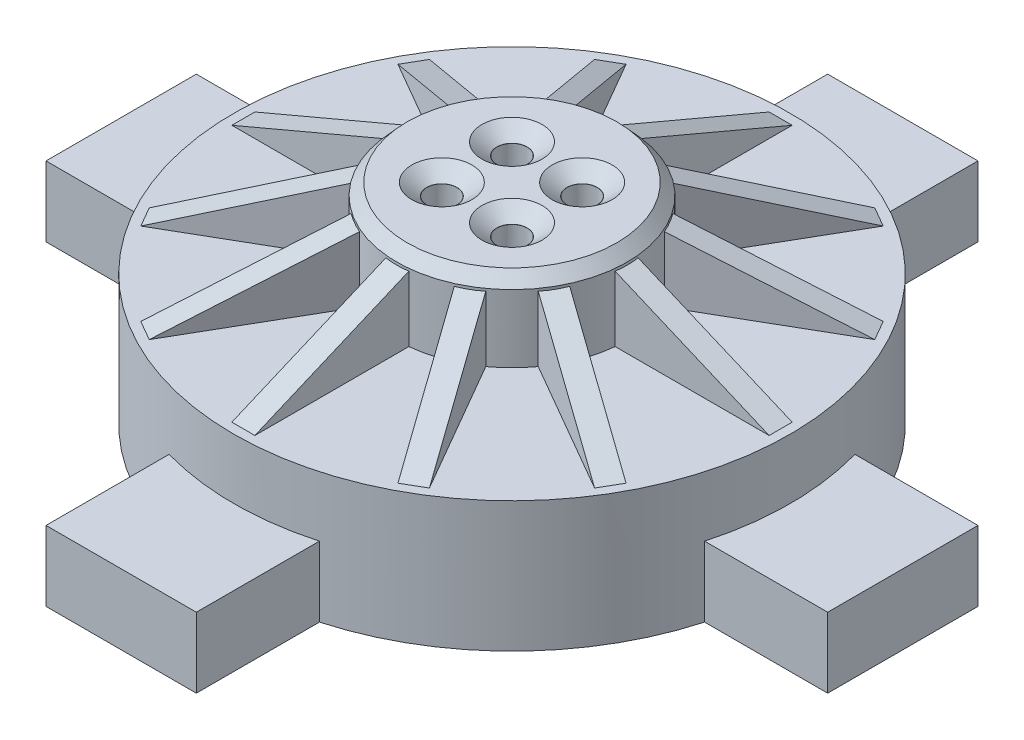
from build123d import *

# Parameters (mm, degrees)
SALIENTE_EXTRUIR1_DEPTH         = 7
CROQUIS2_R                      = 27.75
SALIENTE_EXTRUIR2_DEPTH         = 6
CROQUIS3_R                      = 11.5
SALIENTE_EXTRUIR3_DEPTH         = 6.7
NERVIO5_START                   = -19.605376538
NERVIO5_OUTLINE_W               = 2.3
NERVIO5_OUTLINE_H               = 7.43309969
NERVIO5_DEPTH                   = 16.688717133
MATRIZC1_COUNT                  = 12
CROQUIS5_R                      = 8.65
SALIENTE_EXTRUIR4_DEPTH         = 1.2
CHAFL_N1_SIZE                   = 2.9
CHAFL_N1_SIZE_2                 = 3.2
CORTAR_EXTRUIR1_DEPTH           = 12.6
CROQUIS7_R                      = 3
CORTAR_EXTRUIR2_DEPTH           = 1.2
CORTAR_EXTRUIR2_DRAFT           = -51
CORTAR_EXTRUIR2_PROFILE_2_DEPTH = 1.2
CORTAR_EXTRUIR2_PROFILE_2_DRAFT = -51
CORTAR_EXTRUIR2_PROFILE_3_DEPTH = 1.2
CORTAR_EXTRUIR2_PROFILE_3_DRAFT = -51
CORTAR_EXTRUIR2_PROFILE_4_DEPTH = 1.2
CORTAR_EXTRUIR2_PROFILE_4_DRAFT = -51


# Read off the part's stored shape, not the designer's step: Nervio5
with BuildPart() as part:
    # Croquis1 → Saliente-Extruir1 (new body)
    with BuildSketch(Plane(origin=(0, 0, 0), x_dir=(1, 0, 0), z_dir=(0, 1, 0))):
        with BuildLine():
            Line((-7.5, -39), (7.5, -39))
            Line((7.5, -39), (7.5, -26.717269696))
            ThreePointArc((7.5, -26.717269696), (19.622213178, -19.622213178), (26.717269696, -7.5))
            Line((26.717269696, -7.5), (39, -7.5))
            Line((39, -7.5), (39, 7.5))
            Line((39, 7.5), (26.717269696, 7.5))
            ThreePointArc((26.717269696, 7.5), (19.622213178, 19.622213178), (7.5, 26.717269696))
            Line((7.5, 26.717269696), (7.5, 39))
            Line((7.5, 39), (-7.5, 39))
            Line((-7.5, 39), (-7.5, 26.717269696))
            ThreePointArc((-7.5, 26.717269696), (-19.622213178, 19.622213178), (-26.717269696, 7.5))
            Line((-26.717269696, 7.5), (-39, 7.5))
            Line((-39, 7.5), (-39, -7.5))
            Line((-39, -7.5), (-26.717269696, -7.5))
            ThreePointArc((-26.717269696, -7.5), (-19.622213178, -19.622213178), (-7.5, -26.717269696))
            Line((-7.5, -26.717269696), (-7.5, -39))
        make_face()
    extrude(amount=SALIENTE_EXTRUIR1_DEPTH)

    # Croquis2 → Saliente-Extruir2 (add)
    with BuildSketch(Plane(origin=(0, 7, 0), x_dir=(1, 0, 0), z_dir=(0, 1, 0))):
        with Locations(Location((0, 0, 0), (0, 0, 105.680350135))):
            Circle(CROQUIS2_R)
    extrude(amount=SALIENTE_EXTRUIR2_DEPTH)

    # Croquis3 → Saliente-Extruir3 (add)
    with BuildSketch(Plane(origin=(0, 13, 0), x_dir=(1, 0, 0), z_dir=(0, 1, 0))):
        with Locations(Location((0, 0, 0), (0, 0, 270))):
            Circle(CROQUIS3_R)
    extrude(amount=SALIENTE_EXTRUIR3_DEPTH)

    # Nervio5 outline → Nervio5 (add)
    with BuildSketch(Plane(origin=(0, 0, 0), x_dir=(1, 0, 0), z_dir=(0, 0.39036530164811784, 0.9206600519568415)).offset(NERVIO5_START)):
        with Locations((0, 18.716549845)):
            Rectangle(NERVIO5_OUTLINE_W, NERVIO5_OUTLINE_H)
    nervio5 = extrude(amount=NERVIO5_DEPTH)

    # MatrizC1: Nervio5 ×12 about axis
    matrizc1_axis = Axis((0, 0, 0), (0, 1, 0))
    for i in range(1, MATRIZC1_COUNT):
        add(nervio5.rotate(matrizc1_axis, i * 360 / MATRIZC1_COUNT))

    # Croquis5 → Saliente-Extruir4 (add)
    with BuildSketch(Plane(origin=(0, 19.7, 0), x_dir=(1, 0, 0), z_dir=(0, 1, 0))):
        with Locations(Location((0, 0, 0), (0, 0, 270))):
            Circle(CROQUIS5_R)
    extrude(amount=SALIENTE_EXTRUIR4_DEPTH)

    # Chaflán1
    # the kernel refuses this chamfer: 3.2, 2.9 mm, written as the material it adds along each edge
    with BuildSketch(Plane(origin=(0, 19.7, 0), x_dir=(0, 0, 1), z_dir=(-1, 0, 0))) as chafl_n1_piece_1_section:
        Polygon((8.65 + CHAFL_N1_SIZE, 0), (8.65, CHAFL_N1_SIZE_2), (8.65, 0), align=None)
    chafl_n1_piece_1 = revolve(axis=Axis((0, 19.7, 0), (0, 1, 0)), mode=Mode.PRIVATE)
    chafl_n1_piece_1 = chafl_n1_piece_1 & Plane(origin=(0, 20.288796189, 0), x_dir=(0, 0, 1), z_dir=(0, -1, 0)) * Cylinder(11.5, 47, mode=Mode.PRIVATE)
    chafl_n1_piece_1 = split(chafl_n1_piece_1, bisect_by=Plane(origin=(0, 20.9, -10.938447221), z_dir=(0, -1, 0)), keep=Keep.TOP, mode=Mode.PRIVATE)
    add(chafl_n1_piece_1)

    # Croquis6 → Cortar-Extruir1 (cut)
    with BuildSketch(Plane(origin=(0, 20.9, 0), x_dir=(1, 0, 0), z_dir=(0, 1, 0))):
        with BuildLine():
            ThreePointArc((-2, 3.5), (-4.560660172, 4.560660172), (-3.5, 2))
            Line((-3.5, 2), (-3.5, 3.5))
            Line((-3.5, 3.5), (-2, 3.5))
        make_face()
        with BuildLine():
            Line((-3.5, 3.5), (-3.5, 2))
            ThreePointArc((-3.5, 2), (-2.439339828, 2.439339828), (-2, 3.5))
            Line((-2, 3.5), (-3.5, 3.5))
        make_face()
        with BuildLine():
            ThreePointArc((2, 3.5), (2.439339828, 2.439339828), (3.5, 2))
            Line((3.5, 2), (3.5, 3.5))
            Line((3.5, 3.5), (2, 3.5))
        make_face()
        with BuildLine():
            Line((3.5, 3.5), (3.5, 2))
            ThreePointArc((3.5, 2), (4.560660172, 2.439339828), (5, 3.5))
            ThreePointArc((5, 3.5), (3.5, 5), (2, 3.5))
            Line((2, 3.5), (3.5, 3.5))
        make_face()
        with BuildLine():
            ThreePointArc((3.5, -2), (2.439339828, -2.439339828), (2, -3.5))
            Line((2, -3.5), (3.5, -3.5))
            Line((3.5, -3.5), (3.5, -2))
        make_face()
        with BuildLine():
            Line((3.5, -3.5), (2, -3.5))
            ThreePointArc((2, -3.5), (3.5, -5), (5, -3.5))
            ThreePointArc((5, -3.5), (4.560660172, -2.439339828), (3.5, -2))
            Line((3.5, -2), (3.5, -3.5))
        make_face()
        with BuildLine():
            Line((-3.5, -2), (-3.5, -3.5))
            Line((-3.5, -3.5), (-2, -3.5))
            ThreePointArc((-2, -3.5), (-2.439339828, -2.439339828), (-3.5, -2))
        make_face()
        with BuildLine():
            Line((-2, -3.5), (-3.5, -3.5))
            Line((-3.5, -3.5), (-3.5, -2))
            ThreePointArc((-3.5, -2), (-4.560660172, -4.560660172), (-2, -3.5))
        make_face()
    extrude(amount=-CORTAR_EXTRUIR1_DEPTH, mode=Mode.SUBTRACT)


with BuildPart() as cortar_extruir2_tool:
    # Croquis7 → Cortar-Extruir2 (with draft: the straight prism first)
    with BuildSketch(Plane(origin=(0, 20.9, 0), x_dir=(1, 0, 0), z_dir=(0, 1, 0))):
        with Locations((-3.5, 3.5)):
            Circle(CROQUIS7_R)
    extrude(amount=-CORTAR_EXTRUIR2_DEPTH)
    # Cortar-Extruir2: the draft: its side faces are tilted about the plane it starts from
    cortar_extruir2_sides = [cortar_extruir2_tool.faces().sort_by_distance(p)[0] for p in [
        (-6.5, 20.3, -3.5),
    ]]
    draft(cortar_extruir2_sides, Plane(origin=(0, 20.9, 0), x_dir=(1, 0, 0), z_dir=(0, 1, 0)), CORTAR_EXTRUIR2_DRAFT)


with BuildPart() as part_1:
    add(part.part)

    # Cortar-Extruir2: cut by cortar_extruir2_tool
    add(cortar_extruir2_tool.part, mode=Mode.SUBTRACT)


with BuildPart() as cortar_extruir2_profile_2_tool:
    # Croquis7 → Cortar-Extruir2 profile 2 (with draft: the straight prism first)
    with BuildSketch(Plane(origin=(0, 20.9, 0), x_dir=(1, 0, 0), z_dir=(0, 1, 0))):
        with Locations((3.5, 3.5)):
            Circle(CROQUIS7_R)
    extrude(amount=-CORTAR_EXTRUIR2_PROFILE_2_DEPTH)
    # Cortar-Extruir2 profile 2: the draft: its side faces are tilted about the plane it starts from
    cortar_extruir2_profile_2_sides = [cortar_extruir2_profile_2_tool.faces().sort_by_distance(p)[0] for p in [
        (0.5, 20.3, -3.5),
    ]]
    draft(cortar_extruir2_profile_2_sides, Plane(origin=(0, 20.9, 0), x_dir=(1, 0, 0), z_dir=(0, 1, 0)), CORTAR_EXTRUIR2_PROFILE_2_DRAFT)


with BuildPart() as part_2:
    add(part_1.part)

    # Cortar-Extruir2 profile 2: cut by cortar_extruir2_profile_2_tool
    add(cortar_extruir2_profile_2_tool.part, mode=Mode.SUBTRACT)


with BuildPart() as cortar_extruir2_profile_3_tool:
    # Croquis7 → Cortar-Extruir2 profile 3 (with draft: the straight prism first)
    with BuildSketch(Plane(origin=(0, 20.9, 0), x_dir=(1, 0, 0), z_dir=(0, 1, 0))):
        with Locations((3.5, -3.5)):
            Circle(CROQUIS7_R)
    extrude(amount=-CORTAR_EXTRUIR2_PROFILE_3_DEPTH)
    # Cortar-Extruir2 profile 3: the draft: its side faces are tilted about the plane it starts from
    cortar_extruir2_profile_3_sides = [cortar_extruir2_profile_3_tool.faces().sort_by_distance(p)[0] for p in [
        (0.5, 20.3, 3.5),
    ]]
    draft(cortar_extruir2_profile_3_sides, Plane(origin=(0, 20.9, 0), x_dir=(1, 0, 0), z_dir=(0, 1, 0)), CORTAR_EXTRUIR2_PROFILE_3_DRAFT)


with BuildPart() as part_3:
    add(part_2.part)

    # Cortar-Extruir2 profile 3: cut by cortar_extruir2_profile_3_tool
    add(cortar_extruir2_profile_3_tool.part, mode=Mode.SUBTRACT)


with BuildPart() as cortar_extruir2_profile_4_tool:
    # Croquis7 → Cortar-Extruir2 profile 4 (with draft: the straight prism first)
    with BuildSketch(Plane(origin=(0, 20.9, 0), x_dir=(1, 0, 0), z_dir=(0, 1, 0))):
        with Locations((-3.5, -3.5)):
            Circle(CROQUIS7_R)
    extrude(amount=-CORTAR_EXTRUIR2_PROFILE_4_DEPTH)
    # Cortar-Extruir2 profile 4: the draft: its side faces are tilted about the plane it starts from
    cortar_extruir2_profile_4_sides = [cortar_extruir2_profile_4_tool.faces().sort_by_distance(p)[0] for p in [
        (-6.5, 20.3, 3.5),
    ]]
    draft(cortar_extruir2_profile_4_sides, Plane(origin=(0, 20.9, 0), x_dir=(1, 0, 0), z_dir=(0, 1, 0)), CORTAR_EXTRUIR2_PROFILE_4_DRAFT)


with BuildPart() as part_4:
    add(part_3.part)

    # Cortar-Extruir2 profile 4: cut by cortar_extruir2_profile_4_tool
    add(cortar_extruir2_profile_4_tool.part, mode=Mode.SUBTRACT)


solid = part_4.part
